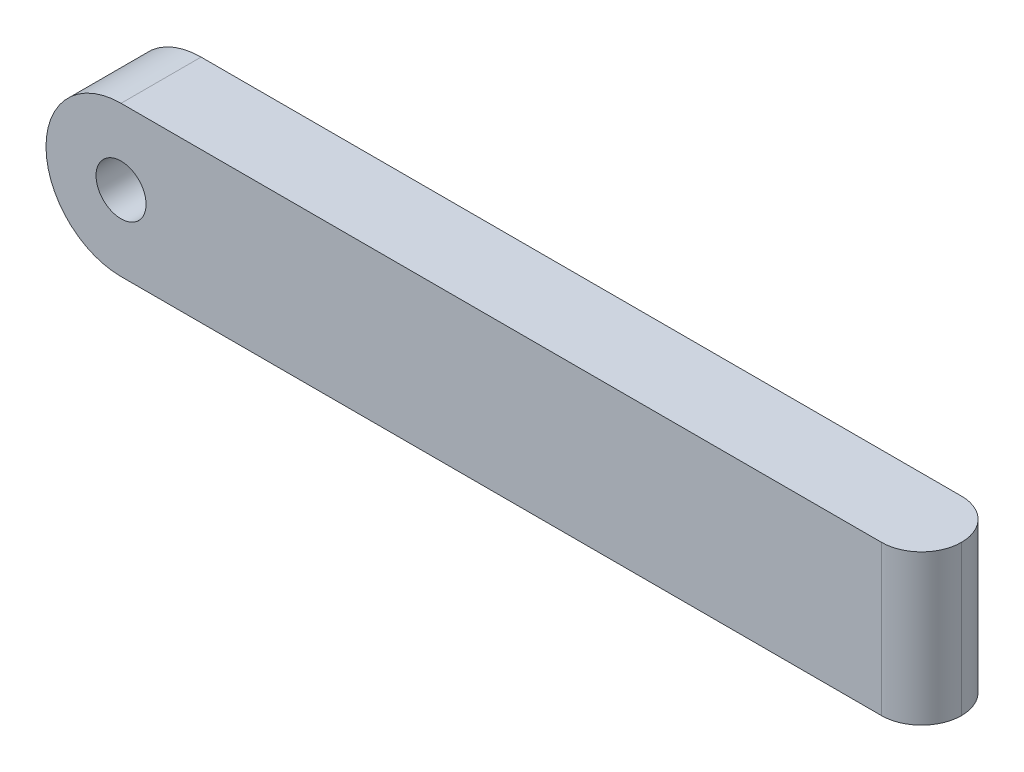
from build123d import *

# Parameters (mm, degrees)
ESQUISSE1_R        = 2.5
BOSS_EXTRU_1_DEPTH = 8
CONG_1_R           = 4


with BuildPart() as part:
    # Esquisse1 → Boss.-Extru.1 (new body)
    with BuildSketch(Plane.XY):
        with BuildLine():
            Line((0, 7.5), (80, 7.5))
            Line((80, 7.5), (80, -7.5))
            Line((80, -7.5), (0, -7.5))
            ThreePointArc((0, -7.5), (-7.5, 0), (0, 7.5))
        make_face()
        Circle(ESQUISSE1_R, mode=Mode.SUBTRACT)
    extrude(amount=BOSS_EXTRU_1_DEPTH)

    # Congé1
    cong_1_edges = [part.edges().sort_by_distance(p)[0] for p in [
        (80, 0, 0),
        (80, 0, 8),
    ]]
    fillet(cong_1_edges, radius=CONG_1_R - 0.0001)  # a hair under: the kernel refuses the full size


solid = part.part
